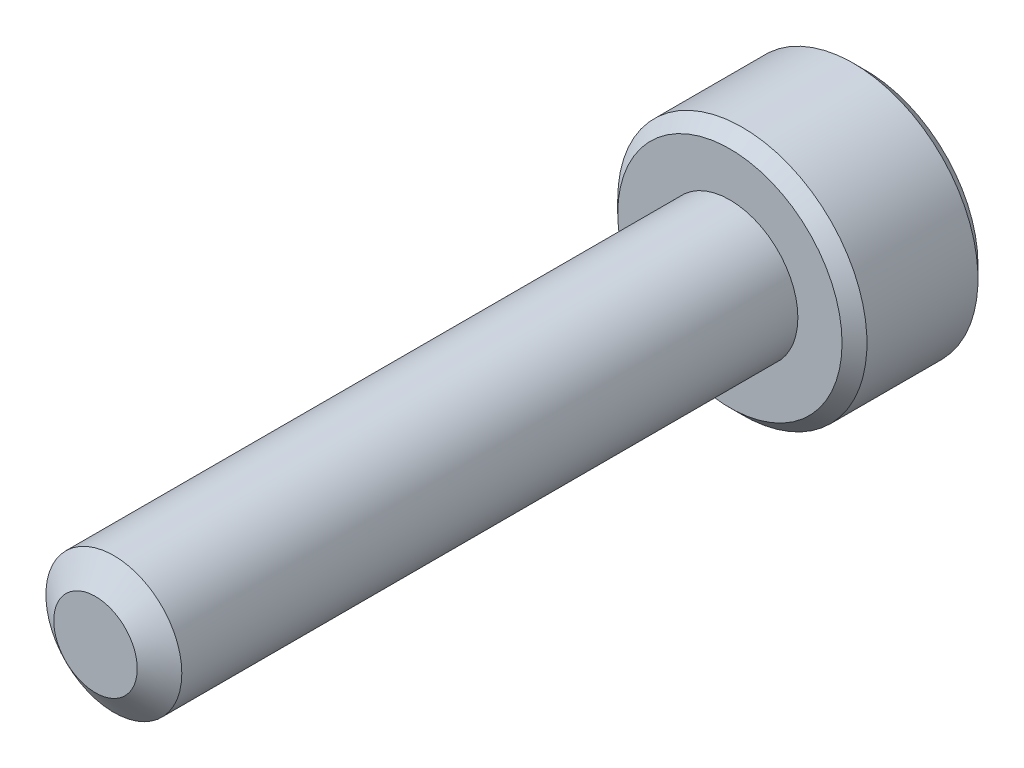
from build123d import *

# Parameters (mm, degrees)
SKETCH1_R          = 1.5
EXTRUDE1_DEPTH     = 14
SKETCH6_R          = 2.75
EXTRUDE2_DEPTH     = 3
CUT_EXTRUDE1_DEPTH = 1.875
CHAMFER1_SIZE      = 0.275


with BuildPart() as part:
    # Sketch1 → Extrude1 (new body)
    with BuildSketch(Plane.XY):
        Circle(SKETCH1_R)
    extrude(amount=-EXTRUDE1_DEPTH)

    # Sketch4 → Cut-Revolve1 (revolve, cut)
    with BuildSketch(Plane(origin=(0, 0, 0), x_dir=(0, 0, -1), z_dir=(1, 0, 0))):
        Polygon((0.405251783, 1.5), (0, 0.921240474), (0, 1.5), align=None)
    revolve(axis=Axis((0, 0, 0), (0, 0, -1)), mode=Mode.SUBTRACT)

    # Sketch6 → Extrude2 (add)
    with BuildSketch(Plane(origin=(0, 0, -14), x_dir=(-1, 0, 0), z_dir=(0, 0, -1))):
        Circle(SKETCH6_R)
    extrude(amount=EXTRUDE2_DEPTH)

    # Sketch7 → Cut-Extrude1 (cut)
    with BuildSketch(Plane(origin=(0, 0, -17), x_dir=(-1, 0, 0), z_dir=(0, 0, -1))):
        Polygon((0, 1.443375673), (-1.25, 0.721687836), (-1.25, -0.721687836), (0, -1.443375673), (1.25, -0.721687836), (1.25, 0.721687836), align=None)
    extrude(amount=-CUT_EXTRUDE1_DEPTH, mode=Mode.SUBTRACT)

    # Cut-Extrude2 cone 1 section (through the dimple's axis) → Cut-Extrude2 (revolve, cut)
    with BuildSketch(Plane(origin=(0, 0, -17), x_dir=(0, 1, 0), z_dir=(1, 0, 0))):
        Polygon((0, 0), (1.443375673, 0), (0, 1.443375673), align=None)
    revolve(axis=Axis((0, 0, -17), (0, 0, 1)), mode=Mode.SUBTRACT)

    # Chamfer1
    chamfer1_edges = [part.edges().sort_by_distance(p)[0] for p in [
        (2.75, 0, -17),
        (2.75, 0, -14),
    ]]
    chamfer(chamfer1_edges, length=CHAMFER1_SIZE)


solid = part.part
